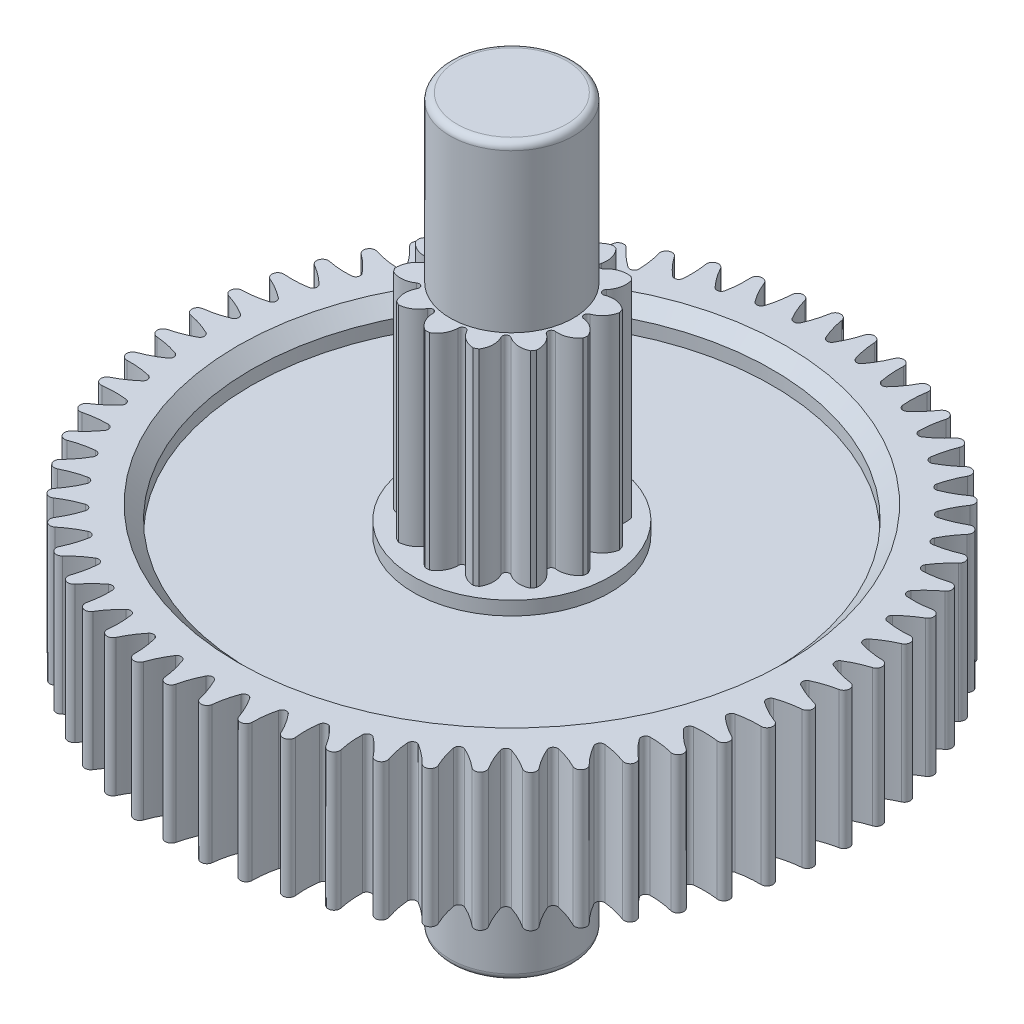
from build123d import *

# Parameters (mm, degrees)
FILLET1_R          = 0.5
CUT_EXTRUDE1_DEPTH = 10
CUT_EXTRUDE2_START = -15
CUT_EXTRUDE2_DEPTH = 15


with BuildPart() as part:
    # Sketch1 → Revolve2 (revolve)
    with BuildSketch(Plane.XY):
        with BuildLine():
            Line((0, 0), (0, 53))
            Line((0, 53), (-4.5, 53))
            Line((-4.5, 53), (-4.5, 41))
            Line((-4.5, 41), (-6.175, 41))
            Line((-6.175, 41), (-6.175, 26))
            Line((-6.175, 26), (-7.175, 26))
            Line((-7.175, 26), (-7.175, 25))
            Line((-7.175, 25), (-19, 25))
            Line((-19, 25), (-19, 26))
            Line((-19, 26), (-20, 27))
            Line((-20, 27), (-24, 27))
            Line((-24, 27), (-24, 17))
            Line((-24, 17), (-20, 17))
            Line((-20, 17), (-19, 18))
            Line((-19, 18), (-19, 19))
            Line((-19, 19), (-8.5, 19))
            ThreePointArc((-8.5, 19), (-5.671572875, 17.828427125), (-4.5, 15))
            Line((-4.5, 15), (-4.5, 0))
            Line((-4.5, 0), (0, 0))
        make_face()
    revolve(axis=Axis((0, 53, 0), (0, -1, 0)))

    # Fillet1
    fillet1_edges = [part.edges().sort_by_distance(p)[0] for p in [
        (4.5, 0, 0),
        (4.5, 53, 0),
    ]]
    fillet(fillet1_edges, radius=FILLET1_R)

    # Sketch3 → Cut-Extrude1 (cut)
    with BuildSketch(Plane(origin=(0, 27, 0), x_dir=(1, 0, 0), z_dir=(0, 1, 0))):
        with BuildLine():
            ThreePointArc((-0.92, 21.980755219), (-0.618669103, 22.793939627), (-0.424408131, 23.639121186))
            ThreePointArc((-0.424408131, 23.639121186), (-0.278547922, 23.897583661), (0, 24))
            ThreePointArc((0, 24), (-1.322106242, 23.963556395), (-2.640197292, 23.854336257))
            ThreePointArc((-2.640197292, 23.854336257), (-2.352073334, 23.783184072), (-2.178665406, 23.542336115))
            ThreePointArc((-2.178665406, 23.542336115), (-1.892606548, 22.72365454), (-1.503647555, 21.948554486))
            ThreePointArc((-1.503647555, 21.948554486), (-1.201993083, 21.786470696), (-0.92, 21.980755219))
        make_face()
        with BuildLine():
            ThreePointArc((2.640197373, 23.854336248), (1.322106283, 23.963556392), (0, 24))
            ThreePointArc((0, 24), (0.278547922, 23.897583661), (0.424408131, 23.639121186))
            ThreePointArc((0.424408131, 23.639121186), (0.618669103, 22.793939627), (0.92, 21.980755219))
            ThreePointArc((0.92, 21.980755219), (1.201993083, 21.786470696), (1.503647555, 21.948554486))
            ThreePointArc((1.503647555, 21.948554486), (1.892606548, 22.72365454), (2.178665406, 23.542336115))
            ThreePointArc((2.178665406, 23.542336115), (2.352073368, 23.783184095), (2.640197373, 23.854336248))
        make_face()
        with BuildLine():
            ThreePointArc((5.248346135, 23.419113195), (3.950270174, 23.67267128), (2.640197373, 23.854336248))
            ThreePointArc((2.640197373, 23.854336248), (2.905788014, 23.721898928), (3.022329929, 23.448959348))
            ThreePointArc((3.022329929, 23.448959348), (3.122434948, 22.587537165), (3.332480001, 21.74613936))
            ThreePointArc((3.332480001, 21.74613936), (3.591388683, 21.522012454), (3.909042865, 21.649928034))
            ThreePointArc((3.909042865, 21.649928034), (4.380908518, 22.377535069), (4.755292897, 23.159778975))
            ThreePointArc((4.755292897, 23.159778975), (4.954143593, 23.380088841), (5.248346135, 23.419113195))
        make_face()
        with BuildLine():
            ThreePointArc((-3.022329929, 23.448959348), (-2.905787986, 23.721898957), (-2.640197292, 23.854336257))
            ThreePointArc((-2.640197292, 23.854336257), (-3.950270177, 23.67267128), (-5.248346221, 23.419113176))
            ThreePointArc((-5.248346221, 23.419113176), (-4.954143631, 23.380088861), (-4.755292897, 23.159778975))
            ThreePointArc((-4.755292897, 23.159778975), (-4.380908518, 22.377535069), (-3.909042865, 21.649928034))
            ThreePointArc((-3.909042865, 21.649928034), (-3.591388683, 21.522012454), (-3.332480001, 21.74613936))
            ThreePointArc((-3.332480001, 21.74613936), (-3.122434948, 22.587537165), (-3.022329929, 23.448959348))
        make_face()
        with BuildLine():
            ThreePointArc((7.792787717, 22.699613644), (6.530483362, 23.094431949), (5.248346135, 23.419113195))
            ThreePointArc((5.248346135, 23.419113195), (5.497755711, 23.258262548), (5.583564735, 22.974158908))
            ThreePointArc((5.583564735, 22.974158908), (5.588298663, 22.1069526), (5.704508209, 21.247554826))
            ThreePointArc((5.704508209, 21.247554826), (5.937189688, 20.996306136), (6.26698769, 21.088500783))
            ThreePointArc((6.26698769, 21.088500783), (6.816032194, 21.759782635), (7.274197574, 22.496093491))
            ThreePointArc((7.274197574, 22.496093491), (7.496077527, 22.693191112), (7.792787717, 22.699613644))
        make_face()
        with BuildLine():
            ThreePointArc((-5.583564735, 22.974158908), (-5.497755737, 23.258262513), (-5.248346221, 23.419113176))
            ThreePointArc((-5.248346221, 23.419113176), (-6.530483172, 23.094432003), (-7.79278726, 22.699613801))
            ThreePointArc((-7.79278726, 22.699613801), (-7.496077302, 22.693191024), (-7.274197574, 22.496093491))
            ThreePointArc((-7.274197574, 22.496093491), (-6.816032194, 21.759782635), (-6.26698769, 21.088500783))
            ThreePointArc((-6.26698769, 21.088500783), (-5.937189688, 20.996306136), (-5.704508209, 21.247554826))
            ThreePointArc((-5.704508209, 21.247554826), (-5.588298663, 22.1069526), (-5.583564735, 22.974158908))
        make_face()
        with BuildLine():
            ThreePointArc((10.242634328, 21.704571915), (9.031425087, 22.235857548), (7.792787717, 22.699613644))
            ThreePointArc((7.792787717, 22.699613644), (8.022988281, 22.512302092), (8.077022629, 22.220483301))
            ThreePointArc((8.077022629, 22.220483301), (7.986328002, 21.358019577), (8.007291415, 20.49105376))
            ThreePointArc((8.007291415, 20.49105376), (8.210921253, 20.215733104), (8.548859774, 20.271087701))
            ThreePointArc((8.548859774, 20.271087701), (9.168418472, 20.877895917), (9.704803345, 21.559335906))
            ThreePointArc((9.704803345, 21.559335906), (9.947018697, 21.730828579), (10.242634328, 21.704571915))
        make_face()
        with BuildLine():
            ThreePointArc((-8.077022629, 22.220483301), (-8.022988157, 22.512302299), (-7.79278726, 22.699613801))
            ThreePointArc((-7.79278726, 22.699613801), (-9.031424881, 22.235857632), (-10.242634364, 21.704571898))
            ThreePointArc((-10.242634364, 21.704571898), (-9.947018716, 21.730828584), (-9.704803345, 21.559335906))
            ThreePointArc((-9.704803345, 21.559335906), (-9.168418472, 20.877895917), (-8.548859774, 20.271087701))
            ThreePointArc((-8.548859774, 20.271087701), (-8.210921253, 20.215733104), (-8.007291415, 20.49105376))
            ThreePointArc((-8.007291415, 20.49105376), (-7.986328002, 21.358019577), (-8.077022629, 22.220483301))
        make_face()
        with BuildLine():
            ThreePointArc((12.568149977, 20.446065787), (11.422737394, 21.10737005), (10.242634328, 21.704571915))
            ThreePointArc((10.242634328, 21.704571915), (10.450832352, 21.49307328), (10.47243641, 21.197081127))
            ThreePointArc((10.47243641, 21.197081127), (10.287414138, 20.349829128), (10.21287695, 19.485819059))
            ThreePointArc((10.21287695, 19.485819059), (10.384983358, 19.189768456), (10.726960281, 19.207611073))
            ThreePointArc((10.726960281, 19.207611073), (11.40951257, 19.742579824), (12.017605951, 20.360877189))
            ThreePointArc((12.017605951, 20.360877189), (12.277216916, 20.504683351), (12.568149977, 20.446065787))
        make_face()
        with BuildLine():
            ThreePointArc((-10.47243641, 21.197081127), (-10.45083236, 21.493073262), (-10.242634364, 21.704571898))
            ThreePointArc((-10.242634364, 21.704571898), (-11.422737378, 21.107370059), (-12.568149912, 20.446065827))
            ThreePointArc((-12.568149912, 20.446065827), (-12.277216878, 20.504683345), (-12.017605951, 20.360877189))
            ThreePointArc((-12.017605951, 20.360877189), (-11.40951257, 19.742579824), (-10.726960281, 19.207611073))
            ThreePointArc((-10.726960281, 19.207611073), (-10.384983358, 19.189768456), (-10.21287695, 19.485819059))
            ThreePointArc((-10.21287695, 19.485819059), (-10.287414138, 20.349829128), (-10.47243641, 21.197081127))
        make_face()
        with BuildLine():
            ThreePointArc((14.741105097, 18.939372232), (13.675393396, 19.722667554), (12.568149977, 20.446065787))
            ThreePointArc((12.568149977, 20.446065787), (12.751817662, 20.21294732), (12.740728999, 19.916375103))
            ThreePointArc((12.740728999, 19.916375103), (12.463625002, 19.094619321), (12.294491993, 18.244052911))
            ThreePointArc((12.294491993, 18.244052911), (12.432985832, 17.930866015), (12.774850021, 17.910980066))
            ThreePointArc((12.774850021, 17.910980066), (13.512110641, 18.367615556), (14.1845311, 18.915265004))
            ThreePointArc((14.1845311, 18.915265004), (14.458386233, 19.029639018), (14.741105097, 18.939372232))
        make_face()
        with BuildLine():
            ThreePointArc((-12.740728999, 19.916375103), (-12.75181765, 20.212947356), (-12.568149912, 20.446065827))
            ThreePointArc((-12.568149912, 20.446065827), (-13.675393345, 19.72266759), (-14.741105059, 18.939372261))
            ThreePointArc((-14.741105059, 18.939372261), (-14.458386209, 19.029639017), (-14.1845311, 18.915265004))
            ThreePointArc((-14.1845311, 18.915265004), (-13.512110641, 18.367615556), (-12.774850021, 17.910980066))
            ThreePointArc((-12.774850021, 17.910980066), (-12.432985832, 17.930866015), (-12.294491993, 18.244052911))
            ThreePointArc((-12.294491993, 18.244052911), (-12.463625002, 19.094619321), (-12.740728999, 19.916375103))
        make_face()
        with BuildLine():
            ThreePointArc((16.735123213, 17.202780328), (15.762048567, 18.098558644), (14.741105097, 18.939372232))
            ThreePointArc((14.741105097, 18.939372232), (14.898013136, 18.687463673), (14.854366398, 18.393911265))
            ThreePointArc((14.854366398, 18.393911265), (14.488544342, 17.607626701), (14.226868559, 16.780828675))
            ThreePointArc((14.226868559, 16.780828675), (14.3300687, 16.45430715), (14.667670388, 16.396934024))
            ThreePointArc((14.667670388, 16.396934024), (15.450689992, 16.769693317), (16.179275257, 17.240047125))
            ThreePointArc((16.179275257, 17.240047125), (16.464050352, 17.323600651), (16.735123213, 17.202780328))
        make_face()
        with BuildLine():
            ThreePointArc((-14.854366398, 18.393911265), (-14.898013131, 18.687463696), (-14.741105059, 18.939372261))
            ThreePointArc((-14.741105059, 18.939372261), (-15.762048531, 18.098558675), (-16.735123179, 17.202780362))
            ThreePointArc((-16.735123179, 17.202780362), (-16.464050328, 17.323600653), (-16.179275257, 17.240047125))
            ThreePointArc((-16.179275257, 17.240047125), (-15.450689992, 16.769693317), (-14.667670388, 16.396934024))
            ThreePointArc((-14.667670388, 16.396934024), (-14.3300687, 16.45430715), (-14.226868559, 16.780828675))
            ThreePointArc((-14.226868559, 16.780828675), (-14.488544342, 17.607626701), (-14.854366398, 18.393911265))
        make_face()
        with BuildLine():
            ThreePointArc((18.525999644, 15.25736993), (17.657373862, 16.254757713), (16.735123213, 17.202780328))
            ThreePointArc((16.735123213, 17.202780328), (16.86336692, 16.935139509), (16.78769191, 16.64817026))
            ThreePointArc((16.78769191, 16.64817026), (16.337592381, 15.906901345), (15.986550212, 15.11390791))
            ThreePointArc((15.986550212, 15.11390791), (16.053203946, 14.778015286), (16.382445105, 14.683851415))
            ThreePointArc((16.382445105, 14.683851415), (17.201718897, 14.968209718), (17.977624928, 15.355558428))
            ThreePointArc((17.977624928, 15.355558428), (18.269863232, 15.407277234), (18.525999644, 15.25736993))
        make_face()
        with BuildLine():
            ThreePointArc((-16.78769191, 16.64817026), (-16.863366917, 16.935139532), (-16.735123179, 17.202780362))
            ThreePointArc((-16.735123179, 17.202780362), (-17.657373846, 16.25475773), (-18.525999644, 15.25736993))
            ThreePointArc((-18.525999644, 15.25736993), (-18.269863232, 15.407277234), (-17.977624928, 15.355558428))
            ThreePointArc((-17.977624928, 15.355558428), (-17.201718897, 14.968209718), (-16.382445105, 14.683851415))
            ThreePointArc((-16.382445105, 14.683851415), (-16.053203946, 14.778015286), (-15.986550212, 15.11390791))
            ThreePointArc((-15.986550212, 15.11390791), (-16.337592381, 15.906901345), (-16.78769191, 16.64817026))
        make_face()
        with BuildLine():
            ThreePointArc((20.09199551, 13.126755746), (19.338362563, 14.213646027), (18.525999644, 15.25736993))
            ThreePointArc((18.525999644, 15.25736993), (18.624022274, 14.977245661), (18.517237584, 14.700343021))
            ThreePointArc((18.517237584, 14.700343021), (17.988324179, 14.013087755), (17.552176802, 13.263524778))
            ThreePointArc((17.552176802, 13.263524778), (17.581475043, 12.922338336), (17.898359131, 12.792526741))
            ThreePointArc((17.898359131, 12.792526741), (18.743942237, 12.985032329), (19.557750587, 13.284674053))
            ThreePointArc((19.557750587, 13.284674053), (19.853904707, 13.303930342), (20.09199551, 13.126755746))
        make_face()
        with BuildLine():
            ThreePointArc((-18.517237584, 14.700343021), (-18.624022274, 14.977245661), (-18.525999644, 15.25736993))
            ThreePointArc((-18.525999644, 15.25736993), (-19.338362527, 14.213646077), (-20.091995442, 13.12675585))
            ThreePointArc((-20.091995442, 13.12675585), (-19.853904648, 13.303930359), (-19.557750587, 13.284674053))
            ThreePointArc((-19.557750587, 13.284674053), (-18.743942237, 12.985032329), (-17.898359131, 12.792526741))
            ThreePointArc((-17.898359131, 12.792526741), (-17.581475043, 12.922338336), (-17.552176802, 13.263524778))
            ThreePointArc((-17.552176802, 13.263524778), (-17.988324179, 14.013087755), (-18.517237584, 14.700343021))
        make_face()
        with BuildLine():
            ThreePointArc((21.414101712, 10.836800629), (20.784609697, 11.999999989), (20.09199551, 13.126755746))
            ThreePointArc((20.09199551, 13.126755746), (20.158607222, 12.837548355), (20.022009078, 12.574073532))
            ThreePointArc((20.022009078, 12.574073532), (19.42070209, 11.949174262), (18.904743742, 11.252140421))
            ThreePointArc((18.904743742, 11.252140421), (18.896330849, 10.909801703), (19.197011323, 10.745918122))
            ThreePointArc((19.197011323, 10.745918122), (20.05863951, 10.844234238), (20.900471646, 11.05253173))
            ThreePointArc((20.900471646, 11.05253173), (21.19694662, 11.039091777), (21.414101712, 10.836800629))
        make_face()
        with BuildLine():
            ThreePointArc((-20.022009078, 12.574073532), (-20.15860723, 12.837548416), (-20.091995442, 13.12675585))
            ThreePointArc((-20.091995442, 13.12675585), (-20.784609678, 12.000000022), (-21.414101734, 10.836800586))
            ThreePointArc((-21.414101734, 10.836800586), (-21.196946642, 11.039091768), (-20.900471646, 11.05253173))
            ThreePointArc((-20.900471646, 11.05253173), (-20.05863951, 10.844234238), (-19.197011323, 10.745918122))
            ThreePointArc((-19.197011323, 10.745918122), (-18.896330849, 10.909801703), (-18.904743742, 11.252140421))
            ThreePointArc((-18.904743742, 11.252140421), (-19.42070209, 11.949174262), (-20.022009078, 12.574073532))
        make_face()
        with BuildLine():
            ThreePointArc((22.476269801, 8.415301292), (21.97855984, 9.64069019), (21.414101712, 10.836800629))
            ThreePointArc((21.414101712, 10.836800629), (21.448493997, 10.542020657), (21.283740504, 10.295171823))
            ThreePointArc((21.283740504, 10.295171823), (20.617338985, 9.74021398), (20.027832702, 9.104170323))
            ThreePointArc((20.027832702, 9.104170323), (19.981810797, 8.764834856), (20.262637802, 8.568868613))
            ThreePointArc((20.262637802, 8.568868613), (21.129852071, 8.571801833), (21.989489293, 8.686226645))
            ThreePointArc((21.989489293, 8.686226645), (22.282686389, 8.640253562), (22.476269801, 8.415301292))
        make_face()
        with BuildLine():
            ThreePointArc((-21.283740504, 10.295171823), (-21.448493991, 10.542020634), (-21.414101734, 10.836800586))
            ThreePointArc((-21.414101734, 10.836800586), (-21.978559856, 9.640690155), (-22.476269811, 8.415301264))
            ThreePointArc((-22.476269811, 8.415301264), (-22.282686402, 8.640253555), (-21.989489293, 8.686226645))
            ThreePointArc((-21.989489293, 8.686226645), (-21.129852071, 8.571801833), (-20.262637802, 8.568868613))
            ThreePointArc((-20.262637802, 8.568868613), (-19.981810797, 8.764834856), (-20.027832702, 9.104170323))
            ThreePointArc((-20.027832702, 9.104170323), (-20.617338985, 9.74021398), (-21.283740504, 10.295171823))
        make_face()
        with BuildLine():
            ThreePointArc((23.265606381, 5.891651696), (22.90572005, 7.164355449), (22.476269801, 8.415301292))
            ThreePointArc((22.476269801, 8.415301292), (22.478025092, 8.118527033), (22.287116152, 7.891300674))
            ThreePointArc((22.287116152, 7.891300674), (21.563709314, 7.413020695), (20.907810903, 6.845687929))
            ThreePointArc((20.907810903, 6.845687929), (20.824738629, 6.513474787), (21.082303307, 6.287804647))
            ThreePointArc((21.082303307, 6.287804647), (21.94457685, 6.195319366), (22.811584327, 6.214482535))
            ThreePointArc((22.811584327, 6.214482535), (23.097944482, 6.136534398), (23.265606381, 5.891651696))
        make_face()
        with BuildLine():
            ThreePointArc((-22.287116152, 7.891300674), (-22.478025087, 8.118527019), (-22.476269811, 8.415301264))
            ThreePointArc((-22.476269811, 8.415301264), (-22.905720054, 7.164355435), (-23.265606382, 5.891651696))
            ThreePointArc((-23.265606382, 5.891651696), (-23.097944482, 6.136534398), (-22.811584327, 6.214482535))
            ThreePointArc((-22.811584327, 6.214482535), (-21.94457685, 6.195319366), (-21.082303307, 6.287804647))
            ThreePointArc((-21.082303307, 6.287804647), (-20.824738629, 6.513474787), (-20.907810903, 6.845687929))
            ThreePointArc((-20.907810903, 6.845687929), (-21.563709314, 7.413020695), (-22.287116152, 7.891300674))
        make_face()
        with BuildLine():
            ThreePointArc((23.772530038, 3.296485342), (23.554835842, 4.601055146), (23.265606381, 5.891651696))
            ThreePointArc((23.265606381, 5.891651696), (23.23470343, 5.596485538), (23.019956401, 5.391639825))
            ThreePointArc((23.019956401, 5.391639825), (22.248325423, 4.995843381), (21.533996603, 4.504108158))
            ThreePointArc((21.533996603, 4.504108158), (21.414882344, 4.183049957), (21.646058208, 3.930415251))
            ThreePointArc((21.646058208, 3.930415251), (22.492924194, 3.743634114), (23.356777629, 3.667303025))
            ThreePointArc((23.356777629, 3.667303025), (23.632824855, 3.558325993), (23.772530038, 3.296485342))
        make_face()
        with BuildLine():
            ThreePointArc((-23.019956401, 5.391639825), (-23.23470343, 5.596485538), (-23.265606382, 5.891651696))
            ThreePointArc((-23.265606382, 5.891651696), (-23.554835842, 4.601055146), (-23.772530038, 3.296485342))
            ThreePointArc((-23.772530038, 3.296485342), (-23.632824855, 3.558325993), (-23.356777629, 3.667303025))
            ThreePointArc((-23.356777629, 3.667303025), (-22.492924194, 3.743634114), (-21.646058208, 3.930415251))
            ThreePointArc((-21.646058208, 3.930415251), (-21.414882344, 4.183049957), (-21.533996603, 4.504108158))
            ThreePointArc((-21.533996603, 4.504108158), (-22.248325423, 4.995843381), (-23.019956401, 5.391639825))
        make_face()
        with BuildLine():
            ThreePointArc((23.990887368, 0.661304221), (23.918027834, 1.98190427), (23.772530038, 3.296485342))
            ThreePointArc((23.772530038, 3.296485342), (23.709343921, 3.006510251), (23.473365563, 2.826531772))
            ThreePointArc((23.473365563, 2.826531772), (22.662876999, 2.518023295), (21.898788755, 2.107854615))
            ThreePointArc((21.898788755, 2.107854615), (21.745078397, 1.801848568), (21.947059286, 1.525315937))
            ThreePointArc((21.947059286, 1.525315937), (22.768237908, 1.246506215), (23.61845129, 1.075607425))
            ThreePointArc((23.61845129, 1.075607425), (23.88083471, 0.936924363), (23.990887368, 0.661304221))
        make_face()
        with BuildLine():
            ThreePointArc((-23.473365563, 2.826531772), (-23.709343921, 3.006510251), (-23.772530038, 3.296485342))
            ThreePointArc((-23.772530038, 3.296485342), (-23.918027835, 1.981904261), (-23.990887369, 0.661304202))
            ThreePointArc((-23.990887369, 0.661304202), (-23.880834716, 0.936924356), (-23.61845129, 1.075607425))
            ThreePointArc((-23.61845129, 1.075607425), (-22.768237908, 1.246506215), (-21.947059286, 1.525315937))
            ThreePointArc((-21.947059286, 1.525315937), (-21.745078397, 1.801848568), (-21.898788755, 2.107854615))
            ThreePointArc((-21.898788755, 2.107854615), (-22.662876999, 2.518023295), (-23.473365563, 2.826531772))
        make_face()
        with BuildLine():
            ThreePointArc((23.918027836, -1.981904251), (23.990887369, -0.661304195), (23.990887368, 0.661304221))
            ThreePointArc((23.990887368, 0.661304221), (23.896185122, 0.380040044), (23.641839864, 0.227113452))
            ThreePointArc((23.641839864, 0.227113452), (22.802331949, 0.009637818), (21.997759276, -0.313985428))
            ThreePointArc((21.997759276, -0.313985428), (21.811318655, -0.601224823), (21.981652794, -0.898298645))
            ThreePointArc((21.981652794, -0.898298645), (22.767176057, -1.265752581), (23.593428948, -1.529144593))
            ThreePointArc((23.593428948, -1.529144593), (23.83896359, -1.69585026), (23.918027836, -1.981904251))
        make_face()
        with BuildLine():
            ThreePointArc((-23.641839864, 0.227113452), (-23.896185117, 0.380040037), (-23.990887369, 0.661304202))
            ThreePointArc((-23.990887369, 0.661304202), (-23.990887369, -0.661304204), (-23.918027836, -1.981904251))
            ThreePointArc((-23.918027836, -1.981904251), (-23.83896359, -1.69585026), (-23.593428948, -1.529144593))
            ThreePointArc((-23.593428948, -1.529144593), (-22.767176057, -1.265752581), (-21.981652794, -0.898298645))
            ThreePointArc((-21.981652794, -0.898298645), (-21.811318655, -0.601224823), (-21.997759276, -0.313985428))
            ThreePointArc((-21.997759276, -0.313985428), (-22.802331949, 0.009637818), (-23.641839864, 0.227113452))
        make_face()
        with BuildLine():
            ThreePointArc((-23.523334256, -2.375061717), (-23.792959006, -2.251043343), (-23.918027836, -1.981904251))
            ThreePointArc((-23.918027836, -1.981904251), (-23.77253004, -3.296485328), (-23.554835853, -4.601055089))
            ThreePointArc((-23.554835853, -4.601055089), (-23.507719748, -4.308039556), (-23.282014338, -4.115334867))
            ThreePointArc((-23.282014338, -4.115334867), (-22.489751529, -3.762646855), (-21.749418814, -3.311009099))
            ThreePointArc((-21.749418814, -3.311009099), (-21.612799051, -2.997000158), (-21.829706798, -2.732014113))
            ThreePointArc((-21.829706798, -2.732014113), (-22.664997478, -2.498864649), (-23.523334256, -2.375061717))
        make_face()
        with BuildLine():
            ThreePointArc((23.554835843, -4.601055141), (23.772530036, -3.296485355), (23.918027836, -1.981904251))
            ThreePointArc((23.918027836, -1.981904251), (23.792959006, -2.251043343), (23.523334256, -2.375061717))
            ThreePointArc((23.523334256, -2.375061717), (22.664997478, -2.498864649), (21.829706798, -2.732014113))
            ThreePointArc((21.829706798, -2.732014113), (21.612799051, -2.997000158), (21.749418814, -3.311009099))
            ThreePointArc((21.749418814, -3.311009099), (22.489751529, -3.762646855), (23.282014338, -4.115334867))
            ThreePointArc((23.282014338, -4.115334867), (23.507719761, -4.308039579), (23.554835843, -4.601055141))
        make_face()
        with BuildLine():
            ThreePointArc((-23.119287236, -4.948406855), (-23.400918602, -4.854802115), (-23.554835853, -4.601055089))
            ThreePointArc((-23.554835853, -4.601055089), (-23.265606394, -5.891651645), (-22.90572005, -7.164355448))
            ThreePointArc((-22.90572005, -7.164355448), (-22.891124056, -6.867935132), (-22.687987613, -6.65157055))
            ThreePointArc((-22.687987613, -6.65157055), (-21.939331883, -6.213867694), (-21.253176352, -5.683528388))
            ThreePointArc((-21.253176352, -5.683528388), (-21.151929344, -5.356395971), (-21.396671251, -5.116879847))
            ThreePointArc((-21.396671251, -5.116879847), (-22.25254064, -4.977034285), (-23.119287236, -4.948406855))
        make_face()
        with BuildLine():
            ThreePointArc((22.905720027, -7.164355522), (23.265606378, -5.891651709), (23.554835843, -4.601055141))
            ThreePointArc((23.554835843, -4.601055141), (23.400918581, -4.854802131), (23.119287236, -4.948406855))
            ThreePointArc((23.119287236, -4.948406855), (22.25254064, -4.977034285), (21.396671251, -5.116879847))
            ThreePointArc((21.396671251, -5.116879847), (21.151929344, -5.356395971), (21.253176352, -5.683528388))
            ThreePointArc((21.253176352, -5.683528388), (21.939331883, -6.213867694), (22.687987613, -6.65157055))
            ThreePointArc((22.687987613, -6.65157055), (22.891124071, -6.867935168), (22.905720027, -7.164355522))
        make_face()
        with BuildLine():
            ThreePointArc((-22.434603387, -7.461685036), (-22.724822706, -7.399630196), (-22.90572005, -7.164355448))
            ThreePointArc((-22.90572005, -7.164355448), (-22.476269782, -8.415301341), (-21.978559818, -9.64069024))
            ThreePointArc((-21.978559818, -9.64069024), (-21.996661122, -9.344463285), (-21.818559452, -9.107065177))
            ThreePointArc((-21.818559452, -9.107065177), (-21.122598468, -8.589660596), (-20.49894912, -7.987057341))
            ThreePointArc((-20.49894912, -7.987057341), (-20.434303867, -7.650772393), (-20.7039091, -7.439633592))
            ThreePointArc((-20.7039091, -7.439633592), (-21.569968103, -7.394789466), (-22.434603387, -7.461685036))
        make_face()
        with BuildLine():
            ThreePointArc((21.978559818, -9.64069024), (22.476269769, -8.415301378), (22.905720027, -7.164355522))
            ThreePointArc((22.905720027, -7.164355522), (22.724822673, -7.399630217), (22.434603387, -7.461685036))
            ThreePointArc((22.434603387, -7.461685036), (21.569968103, -7.394789466), (20.7039091, -7.439633592))
            ThreePointArc((20.7039091, -7.439633592), (20.434303867, -7.650772393), (20.49894912, -7.987057341))
            ThreePointArc((20.49894912, -7.987057341), (21.122598468, -8.589660596), (21.818559452, -9.107065177))
            ThreePointArc((21.818559452, -9.107065177), (21.996661122, -9.344463285), (21.978559818, -9.64069024))
        make_face()
        with BuildLine():
            ThreePointArc((-21.477593843, -9.884388469), (-21.772878238, -9.854636786), (-21.978559818, -9.64069024))
            ThreePointArc((-21.978559818, -9.64069024), (-21.414101716, -10.83680062), (-20.784609694, -11.999999994))
            ThreePointArc((-20.784609694, -11.999999994), (-20.8351885, -11.70756225), (-20.684283535, -11.45201237))
            ThreePointArc((-20.684283535, -11.45201237), (-20.049465321, -10.861186654), (-19.495892414, -10.193634238))
            ThreePointArc((-19.495892414, -10.193634238), (-19.468633623, -9.852278802), (-19.759829539, -9.672080262))
            ThreePointArc((-19.759829539, -9.672080262), (-20.625565372, -9.72278192), (-21.477593843, -9.884388469))
        make_face()
        with BuildLine():
            ThreePointArc((20.784609718, -11.999999953), (21.414101727, -10.836800599), (21.978559818, -9.64069024))
            ThreePointArc((21.978559818, -9.64069024), (21.772878238, -9.854636786), (21.477593843, -9.884388469))
            ThreePointArc((21.477593843, -9.884388469), (20.625565372, -9.72278192), (19.759829539, -9.672080262))
            ThreePointArc((19.759829539, -9.672080262), (19.468633623, -9.852278802), (19.495892414, -10.193634238))
            ThreePointArc((19.495892414, -10.193634238), (20.049465321, -10.861186654), (20.684283535, -11.45201237))
            ThreePointArc((20.684283535, -11.45201237), (20.835188496, -11.707562227), (20.784609718, -11.999999953))
        make_face()
        with BuildLine():
            ThreePointArc((-20.259875404, -12.187108816), (-20.556640581, -12.190021406), (-20.784609694, -11.999999994))
            ThreePointArc((-20.784609694, -11.999999994), (-20.091995481, -13.12675579), (-19.338362539, -14.21364606))
            ThreePointArc((-19.338362539, -14.21364606), (-19.420804923, -13.928547299), (-19.298928437, -13.657947646))
            ThreePointArc((-19.298928437, -13.657947646), (-18.732958825, -13.00087262), (-18.256181984, -12.276474224))
            ThreePointArc((-18.256181984, -12.276474224), (-18.26664054, -11.934191893), (-18.575892414, -11.787120981))
            ThreePointArc((-18.575892414, -11.787120981), (-19.430796218, -11.932752973), (-20.259875404, -12.187108816))
        make_face()
        with BuildLine():
            ThreePointArc((19.338362521, -14.213646084), (20.091995486, -13.126755783), (20.784609718, -11.999999953))
            ThreePointArc((20.784609718, -11.999999953), (20.556640604, -12.190021398), (20.259875404, -12.187108816))
            ThreePointArc((20.259875404, -12.187108816), (19.430796218, -11.932752973), (18.575892414, -11.787120981))
            ThreePointArc((18.575892414, -11.787120981), (18.26664054, -11.934191893), (18.256181984, -12.276474224))
            ThreePointArc((18.256181984, -12.276474224), (18.732958825, -13.00087262), (19.298928437, -13.657947646))
            ThreePointArc((19.298928437, -13.657947646), (19.420804924, -13.928547314), (19.338362521, -14.213646084))
        make_face()
        with BuildLine():
            ThreePointArc((-18.796229523, -14.341894171), (-19.090873127, -14.377435693), (-19.338362539, -14.21364606))
            ThreePointArc((-19.338362539, -14.21364606), (-18.52599962, -15.257369959), (-17.657373849, -16.254757727))
            ThreePointArc((-17.657373849, -16.254757727), (-17.770679081, -15.980458659), (-17.67931049, -15.698093939))
            ThreePointArc((-17.67931049, -15.698093939), (-17.189059584, -14.982745603), (-16.794866235, -14.210294442))
            ThreePointArc((-16.794866235, -14.210294442), (-16.842915185, -13.871240061), (-17.166469119, -13.759082018))
            ThreePointArc((-17.166469119, -13.759082018), (-18.00016352, -13.997876569), (-18.796229523, -14.341894171))
        make_face()
        with BuildLine():
            ThreePointArc((17.657373901, -16.25475767), (18.525999635, -15.257369941), (19.338362521, -14.213646084))
            ThreePointArc((19.338362521, -14.213646084), (19.090873112, -14.377435697), (18.796229523, -14.341894171))
            ThreePointArc((18.796229523, -14.341894171), (18.00016352, -13.997876569), (17.166469119, -13.759082018))
            ThreePointArc((17.166469119, -13.759082018), (16.842915185, -13.871240061), (16.794866235, -14.210294442))
            ThreePointArc((16.794866235, -14.210294442), (17.189059584, -14.982745603), (17.67931049, -15.698093939))
            ThreePointArc((17.67931049, -15.698093939), (17.770679083, -15.98045862), (17.657373901, -16.25475767))
        make_face()
        with BuildLine():
            ThreePointArc((-17.104422878, -16.322588358), (-17.393368327, -16.390327387), (-17.657373849, -16.254757727))
            ThreePointArc((-17.657373849, -16.254757727), (-16.735123234, -17.202780308), (-15.762048602, -18.098558613))
            ThreePointArc((-15.762048602, -18.098558613), (-15.904841271, -17.838388868), (-15.845089662, -17.547686636))
            ThreePointArc((-15.845089662, -17.547686636), (-15.436508446, -16.78274835), (-15.129683561, -15.971620936))
            ThreePointArc((-15.129683561, -15.971620936), (-15.214739655, -15.639910165), (-15.548668143, -15.564026438))
            ThreePointArc((-15.548668143, -15.564026438), (-16.35103322, -15.893084906), (-17.104422878, -16.322588358))
        make_face()
        with BuildLine():
            ThreePointArc((15.762048558, -18.098558651), (16.735123241, -17.202780302), (17.657373901, -16.25475767))
            ThreePointArc((17.657373901, -16.25475767), (17.393368365, -16.390327383), (17.104422878, -16.322588358))
            ThreePointArc((17.104422878, -16.322588358), (16.35103322, -15.893084906), (15.548668143, -15.564026438))
            ThreePointArc((15.548668143, -15.564026438), (15.214739655, -15.639910165), (15.129683561, -15.971620936))
            ThreePointArc((15.129683561, -15.971620936), (15.436508446, -16.78274835), (15.845089662, -17.547686636))
            ThreePointArc((15.845089662, -17.547686636), (15.904841267, -17.838388897), (15.762048558, -18.098558651))
        make_face()
        with BuildLine():
            ThreePointArc((-15.204991708, -18.105148434), (-15.484731626, -18.204262708), (-15.762048602, -18.098558613))
            ThreePointArc((-15.762048602, -18.098558613), (-14.741105114, -18.939372218), (-13.675393372, -19.722667571))
            ThreePointArc((-13.675393372, -19.722667571), (-13.845940227, -19.479785244), (-13.818530911, -19.184274189))
            ThreePointArc((-13.818530911, -19.184274189), (-13.496579006, -18.379031268), (-13.280847024, -17.539073588))
            ThreePointArc((-13.280847024, -17.539073588), (-13.401877797, -17.218732946), (-13.742127399, -17.180044661))
            ThreePointArc((-13.742127399, -17.180044661), (-14.503423527, -17.595372721), (-15.204991708, -18.105148434))
        make_face()
        with BuildLine():
            ThreePointArc((13.675393405, -19.722667548), (14.741105107, -18.939372224), (15.762048558, -18.098558651))
            ThreePointArc((15.762048558, -18.098558651), (15.484731597, -18.204262708), (15.204991708, -18.105148434))
            ThreePointArc((15.204991708, -18.105148434), (14.503423527, -17.595372721), (13.742127399, -17.180044661))
            ThreePointArc((13.742127399, -17.180044661), (13.401877797, -17.218732946), (13.280847024, -17.539073588))
            ThreePointArc((13.280847024, -17.539073588), (13.496579006, -18.379031268), (13.818530911, -19.184274189))
            ThreePointArc((13.818530911, -19.184274189), (13.845940232, -19.479785225), (13.675393405, -19.722667548))
        make_face()
        with BuildLine():
            ThreePointArc((-13.120992537, -19.667936534), (-13.388131217, -19.79722294), (-13.675393372, -19.722667571))
            ThreePointArc((-13.675393372, -19.722667571), (-12.568149922, -20.44606582), (-11.422737414, -21.107370039))
            ThreePointArc((-11.422737414, -21.107370039), (-11.618968226, -20.884723399), (-11.624233913, -20.587990641))
            ThreePointArc((-11.624233913, -20.587990641), (-11.392819379, -19.752217642), (-11.270798995, -18.893625645))
            ThreePointArc((-11.270798995, -18.893625645), (-11.426335297, -18.588543634), (-11.768775844, -18.587520414))
            ThreePointArc((-11.768775844, -18.587520414), (-12.479761918, -19.084076547), (-13.120992537, -19.667936534))
        make_face()
        with BuildLine():
            ThreePointArc((11.422737482, -21.107370003), (12.568149972, -20.44606579), (13.675393405, -19.722667548))
            ThreePointArc((13.675393405, -19.722667548), (13.388131237, -19.797222942), (13.120992537, -19.667936534))
            ThreePointArc((13.120992537, -19.667936534), (12.479761918, -19.084076547), (11.768775844, -18.587520414))
            ThreePointArc((11.768775844, -18.587520414), (11.426335297, -18.588543634), (11.270798995, -18.893625645))
            ThreePointArc((11.270798995, -18.893625645), (11.392819379, -19.752217642), (11.624233913, -20.587990641))
            ThreePointArc((11.624233913, -20.587990641), (11.61896824, -20.884723364), (11.422737482, -21.107370003))
        make_face()
        with BuildLine():
            ThreePointArc((-10.877722291, -20.991982528), (-11.129017047, -21.149871702), (-11.422737414, -21.107370039))
            ThreePointArc((-11.422737414, -21.107370039), (-10.242634436, -21.704571864), (-9.031424914, -22.235857618))
            ThreePointArc((-9.031424914, -22.235857618), (-9.250957693, -22.036149295), (-9.288834462, -21.741796775))
            ThreePointArc((-9.288834462, -21.741796775), (-9.150766359, -20.885638852), (-9.123938733, -20.018834681))
            ThreePointArc((-9.123938733, -20.018834681), (-9.312092565, -19.732714583), (-9.652567292, -19.769368848))
            ThreePointArc((-9.652567292, -19.769368848), (-10.304612906, -20.341125535), (-10.877722291, -20.991982528))
        make_face()
        with BuildLine():
            ThreePointArc((9.031424887, -22.235857629), (10.242634458, -21.704571854), (11.422737482, -21.107370003))
            ThreePointArc((11.422737482, -21.107370003), (11.129017084, -21.14987171), (10.877722291, -20.991982528))
            ThreePointArc((10.877722291, -20.991982528), (10.304612906, -20.341125535), (9.652567292, -19.769368848))
            ThreePointArc((9.652567292, -19.769368848), (9.312092565, -19.732714583), (9.123938733, -20.018834681))
            ThreePointArc((9.123938733, -20.018834681), (9.150766359, -20.885638852), (9.288834462, -21.741796775))
            ThreePointArc((9.288834462, -21.741796775), (9.250957686, -22.036149308), (9.031424887, -22.235857629))
        make_face()
        with BuildLine():
            ThreePointArc((-8.502411231, -22.06121429), (-8.734811695, -22.245789674), (-9.031424914, -22.235857618))
            ThreePointArc((-9.031424914, -22.235857618), (-7.792787271, -22.699613797), (-6.53048319, -23.094431998))
            ThreePointArc((-6.53048319, -23.094431998), (-6.770653078, -22.920086172), (-6.840681144, -22.631686949))
            ThreePointArc((-6.840681144, -22.631686949), (-6.79763543, -21.765536698), (-6.866326215, -20.901042182))
            ThreePointArc((-6.866326215, -20.901042182), (-7.084813644, -20.637357108), (-7.41918965, -20.711243926))
            ThreePointArc((-7.41918965, -20.711243926), (-8.004379852, -21.351260815), (-8.502411231, -22.06121429))
        make_face()
        with BuildLine():
            ThreePointArc((6.530483083, -23.094432028), (7.792787205, -22.69961382), (9.031424887, -22.235857629))
            ThreePointArc((9.031424887, -22.235857629), (8.734811681, -22.24578967), (8.502411231, -22.06121429))
            ThreePointArc((8.502411231, -22.06121429), (8.004379852, -21.351260815), (7.41918965, -20.711243926))
            ThreePointArc((7.41918965, -20.711243926), (7.084813644, -20.637357108), (6.866326215, -20.901042182))
            ThreePointArc((6.866326215, -20.901042182), (6.79763543, -21.765536698), (6.840681144, -22.631686949))
            ThreePointArc((6.840681144, -22.631686949), (6.770653047, -22.920086218), (6.530483083, -23.094432028))
        make_face()
        with BuildLine():
            ThreePointArc((-6.023892417, -22.862652795), (-6.234577579, -23.071673904), (-6.53048319, -23.094431998))
            ThreePointArc((-6.53048319, -23.094431998), (-5.248346185, -23.419113184), (-3.950270124, -23.672671289))
            ThreePointArc((-3.950270124, -23.672671289), (-4.208161869, -23.525804304), (-4.309491223, -23.246859101))
            ThreePointArc((-4.309491223, -23.246859101), (-4.361990416, -22.381230413), (-4.525365798, -21.529539345))
            ThreePointArc((-4.525365798, -21.529539345), (-4.771534682, -21.291490073), (-5.095753095, -21.401712558))
            ThreePointArc((-5.095753095, -21.401712558), (-5.60698447, -22.102220711), (-6.023892417, -22.862652795))
        make_face()
        with BuildLine():
            ThreePointArc((3.950270124, -23.672671289), (5.24834613, -23.419113196), (6.530483083, -23.094432028))
            ThreePointArc((6.530483083, -23.094432028), (6.234577529, -23.071673881), (6.023892417, -22.862652795))
            ThreePointArc((6.023892417, -22.862652795), (5.60698447, -22.102220711), (5.095753095, -21.401712558))
            ThreePointArc((5.095753095, -21.401712558), (4.771534682, -21.291490073), (4.525365798, -21.529539345))
            ThreePointArc((4.525365798, -21.529539345), (4.361990416, -22.381230413), (4.309491223, -23.246859101))
            ThreePointArc((4.309491223, -23.246859101), (4.208161869, -23.525804304), (3.950270124, -23.672671289))
        make_face()
        with BuildLine():
            ThreePointArc((-3.472251709, -23.386569666), (-3.658664081, -23.617499238), (-3.950270124, -23.672671289))
            ThreePointArc((-3.950270124, -23.672671289), (-2.640197254, -23.854336261), (-1.322106192, -23.963556397))
            ThreePointArc((-1.322106192, -23.963556397), (-1.594589293, -23.845951011), (-1.725989917, -23.579845875))
            ThreePointArc((-1.725989917, -23.579845875), (-1.873396748, -22.725246309), (-2.129473571, -21.896697064))
            ThreePointArc((-2.129473571, -21.896697064), (-2.400335753, -21.687173191), (-2.710461, -21.832393391))
            ThreePointArc((-2.710461, -21.832393391), (-3.141527891, -22.584889588), (-3.472251709, -23.386569666))
        make_face()
        with BuildLine():
            ThreePointArc((1.322106272, -23.963556393), (2.640197294, -23.854336257), (3.950270124, -23.672671289))
            ThreePointArc((3.950270124, -23.672671289), (3.658664081, -23.617499238), (3.472251709, -23.386569666))
            ThreePointArc((3.472251709, -23.386569666), (3.141527891, -22.584889588), (2.710461, -21.832393391))
            ThreePointArc((2.710461, -21.832393391), (2.400335753, -21.687173191), (2.129473571, -21.896697064))
            ThreePointArc((2.129473571, -21.896697064), (1.873396748, -22.725246309), (1.725989917, -23.579845875))
            ThreePointArc((1.725989917, -23.579845875), (1.594589322, -23.845950984), (1.322106272, -23.963556393))
        make_face()
        with BuildLine():
            ThreePointArc((-0.878462569, -23.626605262), (-1.038339387, -23.876640137), (-1.322106192, -23.963556397))
            ThreePointArc((-1.322106192, -23.963556397), (4e-08, -24), (1.322106272, -23.963556393))
            ThreePointArc((1.322106272, -23.963556393), (1.038339419, -23.876640161), (0.878462569, -23.626605262))
            ThreePointArc((0.878462569, -23.626605262), (0.63793742, -22.7934085), (0.292267581, -21.998058543))
            ThreePointArc((0.292267581, -21.998058543), (0, -21.819603405), (-0.292267581, -21.998058543))
            ThreePointArc((-0.292267581, -21.998058543), (-0.63793742, -22.7934085), (-0.878462569, -23.626605262))
        make_face()
    extrude(amount=-CUT_EXTRUDE1_DEPTH, mode=Mode.SUBTRACT)

    # Sketch4 → Cut-Extrude2 (cut)
    with BuildSketch(Plane(origin=(0, 41, 0), x_dir=(1, 0, 0), z_dir=(0, 1, 0)).offset(CUT_EXTRUDE2_START)):
        with BuildLine():
            ThreePointArc((6.147391741, -0.583266477), (6.129977298, 0.744314001), (5.829174905, 2.037484951))
            ThreePointArc((5.829174905, 2.037484951), (5.496423232, 1.315287075), (4.850934009, 0.850919644))
            ThreePointArc((4.850934009, 0.850919644), (4.666858225, 0.566659181), (4.913613083, 0.334711029))
            ThreePointArc((4.913613083, 0.334711029), (5.651475962, 0.038312954), (6.147391741, -0.583266477))
        make_face()
        with BuildLine():
            ThreePointArc((4.195240341, 2.579841756), (4.986328527, 2.660296272), (5.714302506, 2.340378573))
            ThreePointArc((5.714302506, 2.340378573), (5.081925372, 3.507799811), (4.214611575, 4.513055979))
            ThreePointArc((4.214611575, 4.513055979), (4.255596689, 3.718944105), (3.899846672, 3.007793366))
            ThreePointArc((3.899846672, 3.007793366), (3.868958084, 2.670548944), (4.195240341, 2.579841756))
        make_face()
        with BuildLine():
            ThreePointArc((5.172187612, -3.373292206), (5.773725299, -2.189685177), (6.108344514, -0.904849325))
            ThreePointArc((6.108344514, -0.904849325), (5.478085452, -1.389686373), (4.690730824, -1.500889514))
            ThreePointArc((4.690730824, -1.500889514), (4.395637388, -1.667045371), (4.506336283, -1.98709796))
            ThreePointArc((4.506336283, -1.98709796), (5.021938362, -2.5924474), (5.172187612, -3.373292206))
        make_face()
        with BuildLine():
            ThreePointArc((2.515788595, 4.233961826), (3.178873318, 4.672837774), (3.972135432, 4.727871097))
            ThreePointArc((3.972135432, 4.727871097), (2.869665587, 5.467690958), (1.634531524, 5.954740271))
            ThreePointArc((1.634531524, 5.954740271), (2.03986423, 5.270635859), (2.055351461, 4.475617876))
            ThreePointArc((2.055351461, 4.475617876), (2.184726272, 4.162648128), (2.515788595, 4.233961826))
        make_face()
        with BuildLine():
            ThreePointArc((3.012097633, -5.390537343), (4.094782415, -4.62205387), (4.988166008, -3.639893526))
            ThreePointArc((4.988166008, -3.639893526), (4.204784313, -3.776299421), (3.455937737, -3.508862972))
            ThreePointArc((3.455937737, -3.508862972), (3.117428999, -3.518849919), (3.066712148, -3.853686754))
            ThreePointArc((3.066712148, -3.853686754), (3.241935204, -4.629309297), (3.012097633, -5.390537343))
        make_face()
        with BuildLine():
            ThreePointArc((0.26, 4.918132267), (0.643176542, 5.614888456), (1.32, 6.032265329))
            ThreePointArc((1.32, 6.032265329), (0, 6.175), (-1.32, 6.032265329))
            ThreePointArc((-1.32, 6.032265329), (-0.643176542, 5.614888456), (-0.26, 4.918132267))
            ThreePointArc((-0.26, 4.918132267), (0, 4.70113479), (0.26, 4.918132267))
        make_face()
        with BuildLine():
            ThreePointArc((0.161972385, -6.172875339), (1.477774227, -5.995565723), (2.725258783, -5.541081985))
            ThreePointArc((2.725258783, -5.541081985), (1.968217761, -5.297807781), (1.429430963, -4.712998209))
            ThreePointArc((1.429430963, -4.712998209), (1.125055195, -4.564528357), (0.924541218, -4.837442355))
            ThreePointArc((0.924541218, -4.837442355), (0.71924376, -5.605652223), (0.161972385, -6.172875339))
        make_face()
        with BuildLine():
            ThreePointArc((-2.055351461, 4.475617876), (-2.03986423, 5.270635859), (-1.634531524, 5.954740271))
            ThreePointArc((-1.634531524, 5.954740271), (-2.869665587, 5.467690958), (-3.972135432, 4.727871097))
            ThreePointArc((-3.972135432, 4.727871097), (-3.178873318, 4.672837774), (-2.515788595, 4.233961826))
            ThreePointArc((-2.515788595, 4.233961826), (-2.184726272, 4.162648128), (-2.055351461, 4.475617876))
        make_face()
        with BuildLine():
            ThreePointArc((-2.725258783, -5.541081985), (-1.477774227, -5.995565723), (-0.161972385, -6.172875339))
            ThreePointArc((-0.161972385, -6.172875339), (-0.71924376, -5.605652223), (-0.924541218, -4.837442355))
            ThreePointArc((-0.924541218, -4.837442355), (-1.125055195, -4.564528357), (-1.429430963, -4.712998209))
            ThreePointArc((-1.429430963, -4.712998209), (-1.968217761, -5.297807781), (-2.725258783, -5.541081985))
        make_face()
        with BuildLine():
            ThreePointArc((-3.899846672, 3.007793366), (-4.255596689, 3.718944105), (-4.214611575, 4.513055979))
            ThreePointArc((-4.214611575, 4.513055979), (-5.081925372, 3.507799811), (-5.714302506, 2.340378573))
            ThreePointArc((-5.714302506, 2.340378573), (-4.986328527, 2.660296272), (-4.195240341, 2.579841756))
            ThreePointArc((-4.195240341, 2.579841756), (-3.868958084, 2.670548944), (-3.899846672, 3.007793366))
        make_face()
        with BuildLine():
            ThreePointArc((-4.988166008, -3.639893526), (-4.094782415, -4.62205387), (-3.012097633, -5.390537343))
            ThreePointArc((-3.012097633, -5.390537343), (-3.241935204, -4.629309297), (-3.066712148, -3.853686754))
            ThreePointArc((-3.066712148, -3.853686754), (-3.117428999, -3.518849919), (-3.455937737, -3.508862972))
            ThreePointArc((-3.455937737, -3.508862972), (-4.204784313, -3.776299421), (-4.988166008, -3.639893526))
        make_face()
        with BuildLine():
            ThreePointArc((-4.850934009, 0.850919644), (-5.496423232, 1.315287075), (-5.829174905, 2.037484951))
            ThreePointArc((-5.829174905, 2.037484951), (-6.129977298, 0.744314001), (-6.147391741, -0.583266477))
            ThreePointArc((-6.147391741, -0.583266477), (-5.651475962, 0.038312954), (-4.913613083, 0.334711029))
            ThreePointArc((-4.913613083, 0.334711029), (-4.666858225, 0.566659181), (-4.850934009, 0.850919644))
        make_face()
        with BuildLine():
            ThreePointArc((-6.108344514, -0.904849325), (-5.773725299, -2.189685177), (-5.172187612, -3.373292206))
            ThreePointArc((-5.172187612, -3.373292206), (-5.021938362, -2.5924474), (-4.506336283, -1.98709796))
            ThreePointArc((-4.506336283, -1.98709796), (-4.395637388, -1.667045371), (-4.690730824, -1.500889514))
            ThreePointArc((-4.690730824, -1.500889514), (-5.478085452, -1.389686373), (-6.108344514, -0.904849325))
        make_face()
    extrude(amount=CUT_EXTRUDE2_DEPTH, mode=Mode.SUBTRACT)


solid = part.part
